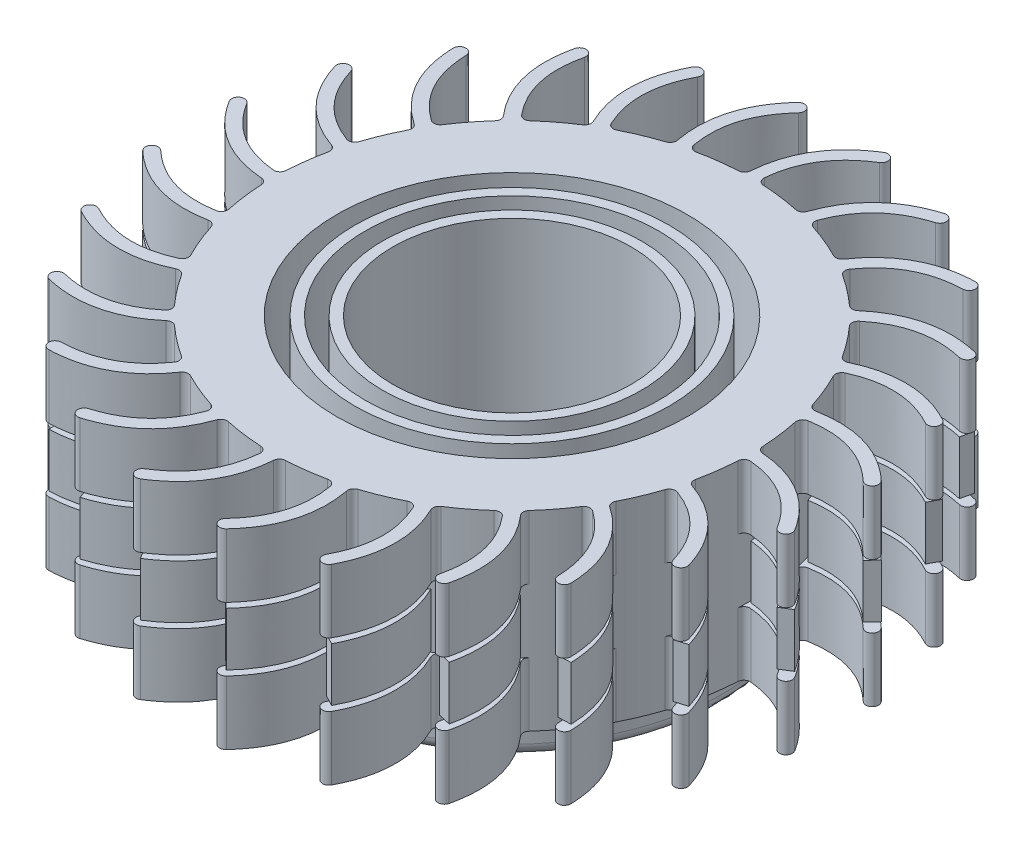
from build123d import *

# Parameters (mm, degrees)
SKETCH1_R                = 18.75
SKETCH1_R_2              = 13.75
BOSS_EXTRUDE1_DEPTH      = 15
BOSS_EXTRUDE2_DEPTH      = 5
FILLET1_R                = 0.5
FILLET2_DEPTH            = 5
CIRPATTERN1_COUNT        = 24
FILLET1_OF_CIRPATTERN1_R = 0.5
MIRROR1_START            = 10
MIRROR1_DEPTH            = 5
SKETCH3_W                = 2.804646897
SKETCH3_H                = 3
FILLET4_R                = 1
CHAMFER1_SIZE            = 1
CHAMFER1_SIZE_2          = 0.73215761
BOSS_EXTRUDE3_DEPTH      = 4.2
CIRPATTERN4_COUNT        = 24
BOSS_EXTRUDE4_REACH      = 44.117
SKETCH6_R                = 12.317160209
SKETCH6_R_2              = 11.517160209
SKETCH6_R_3              = 10.154712578
SKETCH6_R_4              = 9.354712578


with BuildPart() as part:
    # Sketch1 → Boss-Extrude1 (new body)
    with BuildSketch(Plane(origin=(0, 0, 0), x_dir=(1, 0, 0), z_dir=(0, 1, 0))):
        with Locations(Location((0, 0, 0), (0, 0, 270))):
            Circle(SKETCH1_R)
        with Locations(Location((0, 0, 0), (0, 0, 270))):
            Circle(SKETCH1_R_2, mode=Mode.SUBTRACT)
    extrude(amount=BOSS_EXTRUDE1_DEPTH)

    # Sketch2 → Boss-Extrude2 (add)
    with BuildSketch(Plane(origin=(0, 0, 0), x_dir=(1, 0, 0), z_dir=(0, 1, 0))):
        with BuildLine():
            ThreePointArc((18.75, 0), (18.74833243, -0.250062213), (18.743330015, -0.500079947))
            add(Edge.make_bspline(
                [(18.743330015, -0.500079947), (20.249175085, -0.554696371), (22.276517283, -1.391892892), (24.018730993, -2.731723154), (24.82083161, -4.014422972)],
                knots=[0.001258871, 0.001258871, 0.001258871, 0.375, 0.625, 1, 1, 1], degree=2))
            ThreePointArc((24.82083161, -4.014422972), (25.509613501, -4.174358919), (25.669549447, -3.485577028))
            add(Edge.make_bspline(
                [(18.766817552, 0.49971709), (20.440613064, 0.445794798), (22.781173245, -0.517803125), (24.785953616, -2.06298874), (25.669549447, -3.485577028)],
                knots=[0, 0, 0, 0.375, 0.625, 1, 1, 1], degree=2))
            Line((18.766817552, 0.49971709), (18.743339693, 0.49971709))
            ThreePointArc((18.743339693, 0.49971709), (18.748334849, 0.249880736), (18.75, 0))
        make_face()
    boss_extrude2 = extrude(amount=BOSS_EXTRUDE2_DEPTH)

    # Fillet1
    fillet1_edges = [part.edges().sort_by_distance(p)[0] for p in [
        (18.743330015, 2.5, 0.500079947),
    ]]
    fillet(fillet1_edges, radius=FILLET1_R)

    # Fillet2: read off the stored shape, not the designer's step
    # Fillet2 outline → Fillet2 (add)
    with BuildSketch(Plane(origin=(0, 0, 0), x_dir=(1, 0, 0), z_dir=(0, 1, 0))):
        with BuildLine():
            add(Edge.make_bspline(
                [(18.766817552, 0.49971709), (18.979861137, 0.492853767), (19.188539307, 0.47749748)],
                knots=[0, 0, 0, 0.047730648, 0.047730648, 0.047730648], degree=2))
            ThreePointArc((19.188539307, 0.47749748), (18.867686512, 0.626635767), (18.725877539, 0.950794618))
            ThreePointArc((18.725877539, 0.950794618), (18.735966154, 0.725308407), (18.743339693, 0.49971709))
            Line((18.743339693, 0.49971709), (18.766817552, 0.49971709))
        make_face()
    fillet2 = extrude(amount=FILLET2_DEPTH)

    # CirPattern1: Boss-Extrude2, Fillet2 ×24 about axis
    cirpattern1_axis = Axis((0, 15, 0), (0, 1, 0))
    add([boss_extrude2.rotate(cirpattern1_axis, i * 360 / CIRPATTERN1_COUNT) for i in range(1, CIRPATTERN1_COUNT)])
    add([fillet2.rotate(cirpattern1_axis, i * 360 / CIRPATTERN1_COUNT) for i in range(1, CIRPATTERN1_COUNT)])

    # Fillet1 of CirPattern1
    fillet1_of_cirpattern1_edges = [part.edges().sort_by_distance(p)[0] for p in [
        (18.234096746, 2.5, -4.368090641),
        (16.482239918, 2.5, -8.93858307),
        (13.607145677, 2.5, -12.899925834),
        (9.804746945, 2.5, -15.982159971),
        (5.334170912, 2.5, -17.975236318),
        (0.500079947, 2.5, -18.743330015),
        (-4.368090641, 2.5, -18.234096746),
        (-8.93858307, 2.5, -16.482239918),
        (-12.899925834, 2.5, -13.607145677),
        (-15.982159971, 2.5, -9.804746945),
        (-17.975236318, 2.5, -5.334170912),
        (-18.743330015, 2.5, -0.500079947),
        (-18.234096746, 2.5, 4.368090641),
        (-16.482239918, 2.5, 8.93858307),
        (-13.607145677, 2.5, 12.899925834),
        (-9.804746945, 2.5, 15.982159971),
        (-5.334170912, 2.5, 17.975236318),
        (-0.500079947, 2.5, 18.743330015),
        (4.368090641, 2.5, 18.234096746),
        (8.93858307, 2.5, 16.482239918),
        (12.899925834, 2.5, 13.607145677),
        (15.982159971, 2.5, 9.804746945),
        (17.975236318, 2.5, 5.334170912),
    ]]
    fillet(fillet1_of_cirpattern1_edges, radius=FILLET1_OF_CIRPATTERN1_R)

    # Mirror1: read off the stored shape, not the designer's step
    # Mirror1 outline → Mirror1 (add)
    with BuildSketch(Plane(origin=(0, 0, 0), x_dir=(1, 0, 0), z_dir=(0, 1, 0)).offset(MIRROR1_START)):
        with BuildLine():
            ThreePointArc((18.723067695, -1.004607436), (18.895412165, -0.653095529), (19.268186532, -0.533502434))
            add(Edge.make_bspline(
                [(19.268186532, -0.533502434), (20.464567735, -0.643643356), (22.276517283, -1.391892892), (24.018730993, -2.731723154), (24.82083161, -4.014422972)],
                knots=[0.067527533, 0.067527533, 0.067527533, 0.375, 0.625, 1, 1, 1], degree=2))
            ThreePointArc((24.82083161, -4.014422972), (25.509613501, -4.174358919), (25.669549447, -3.485577028))
            add(Edge.make_bspline(
                [(19.188539307, 0.47749748), (20.61935939, 0.372205753), (22.781173245, -0.517803125), (24.785953616, -2.06298874), (25.669549447, -3.485577028)],
                knots=[0.047730648, 0.047730648, 0.047730648, 0.375, 0.625, 1, 1, 1], degree=2))
            ThreePointArc((19.188539307, 0.47749748), (18.867686512, 0.626635767), (18.725877539, 0.950794618))
            ThreePointArc((18.725877539, 0.950794618), (18.749980642, -0.026943063), (18.723067695, -1.004607436))
        make_face()
        with BuildLine():
            ThreePointArc((18.658291127, -4.505132273), (18.386970955, -4.278032935), (18.33389249, -3.928216666))
            ThreePointArc((18.33389249, -3.928216666), (18.104117167, -4.878877086), (17.825083096, -5.81626277))
            ThreePointArc((17.825083096, -5.81626277), (18.082533046, -5.521334371), (18.473558406, -5.502297418))
            add(Edge.make_bspline(
                [(18.473558406, -5.502297418), (19.60066734, -5.91833162), (21.157214974, -7.110052223), (22.493290602, -8.855146965), (22.936073162, -10.301738762)],
                knots=[0.067527533, 0.067527533, 0.067527533, 0.375, 0.625, 1, 1, 1], degree=2))
            ThreePointArc((22.936073162, -10.301738762), (23.55999091, -10.634494895), (23.892747042, -10.010577147))
            add(Edge.make_bspline(
                [(18.658291127, -4.505132273), (20.013105694, -4.977159759), (21.87090628, -6.396360917), (23.407451951, -8.40777095), (23.892747042, -10.010577147)],
                knots=[0.047730648, 0.047730648, 0.047730648, 0.375, 0.625, 1, 1, 1], degree=2))
        make_face()
        with BuildLine():
            ThreePointArc((16.856511241, -9.180744706), (16.653213713, -8.891160762), (16.692482966, -8.539526476))
            ThreePointArc((16.692482966, -8.539526476), (16.224488025, -9.398323698), (15.712348542, -10.231549408))
            ThreePointArc((15.712348542, -10.231549408), (16.037359185, -10.013303401), (16.419987804, -10.096119927))
            add(Edge.make_bspline(
                [(16.419987804, -10.096119927), (17.401013857, -10.789695365), (18.596083429, -12.343673245), (19.434969629, -14.375107144), (19.488259231, -15.88700808)],
                knots=[0.067527533, 0.067527533, 0.067527533, 0.375, 0.625, 1, 1, 1], degree=2))
            ThreePointArc((19.488259231, -15.88700808), (20.004793873, -16.369907618), (20.487693411, -15.853372976))
            add(Edge.make_bspline(
                [(16.856511241, -9.180744706), (18.042991918, -9.987340058), (19.470173196, -11.839017283), (20.433771119, -14.179577464), (20.487693411, -15.853372976)],
                knots=[0.047730648, 0.047730648, 0.047730648, 0.375, 0.625, 1, 1, 1], degree=2))
        make_face()
        with BuildLine():
            ThreePointArc((17.841724979, 5.76501082), (18.118063922, 4.826827085), (18.345106171, 3.875510235))
            ThreePointArc((18.345106171, 3.875510235), (18.420600169, 4.259650695), (18.749719587, 4.47164986))
            add(Edge.make_bspline(
                [(18.749719587, 4.47164986), (19.933841658, 4.674908139), (21.877711753, 4.42112164), (23.907334559, 3.577863075), (25.014091402, 2.546469109)],
                knots=[0.067527533, 0.067527533, 0.067527533, 0.375, 0.625, 1, 1, 1], degree=2))
            ThreePointArc((25.014091402, 2.546469109), (25.720798088, 2.570252719), (25.697014478, 3.276959405))
            add(Edge.make_bspline(
                [(18.411120244, 5.427586568), (19.820437819, 5.696206057), (22.138940901, 5.396042094), (24.475333503, 4.422382744), (25.697014478, 3.276959405)],
                knots=[0.047730648, 0.047730648, 0.047730648, 0.375, 0.625, 1, 1, 1], degree=2))
            ThreePointArc((18.411120244, 5.427586568), (18.062600413, 5.488600278), (17.841724979, 5.76501082))
        make_face()
        with BuildLine():
            ThreePointArc((13.905987971, -13.230704559), (13.784567478, -12.898370677), (13.913508313, -12.568881669))
            ThreePointArc((13.913508313, -12.568881669), (13.239186836, -13.277290082), (12.528843401, -13.949572862))
            ThreePointArc((12.528843401, -13.949572862), (12.899265798, -13.822882352), (13.247422169, -14.001908547))
            add(Edge.make_bspline(
                [(13.247422169, -14.001908547), (14.015510037, -14.925759201), (14.76765953, -16.736093335), (15.052187594, -18.915427527), (14.71235264, -20.389604052)],
                knots=[0.067527533, 0.067527533, 0.067527533, 0.375, 0.625, 1, 1, 1], degree=2))
            ThreePointArc((14.71235264, -20.389604052), (15.086303193, -20.98973819), (15.686437331, -20.615787637))
            add(Edge.make_bspline(
                [(13.905987971, -13.230704559), (14.84327806, -14.316899637), (15.742579984, -16.474864186), (16.067562553, -18.985069208), (15.686437331, -20.615787637)],
                knots=[0.047730648, 0.047730648, 0.047730648, 0.375, 0.625, 1, 1, 1], degree=2))
        make_face()
        with BuildLine():
            ThreePointArc((15.741688348, 10.186351062), (16.251431088, 9.351656944), (16.716955978, 8.491518287))
            ThreePointArc((16.716955978, 8.491518287), (16.690454714, 8.882108763), (16.953490238, 9.172066605))
            add(Edge.make_bspline(
                [(16.953490238, 9.172066605), (18.044657214, 9.67487237), (19.987976321, 9.932844038), (22.166692783, 9.643623848), (23.502682203, 8.933823529)],
                knots=[0.067527533, 0.067527533, 0.067527533, 0.375, 0.625, 1, 1, 1], degree=2))
            ThreePointArc((23.502682203, 8.933823529), (24.179152792, 9.139705882), (23.973270439, 9.816176471))
            add(Edge.make_bspline(
                [(16.379013761, 10.007794601), (17.670786165, 10.632019332), (19.987976321, 10.942155962), (22.496759858, 10.606376152), (23.973270439, 9.816176471)],
                knots=[0.047730648, 0.047730648, 0.047730648, 0.375, 0.625, 1, 1, 1], degree=2))
            ThreePointArc((16.379013761, 10.007794601), (16.026577946, 9.976525749), (15.741688348, 10.186351062))
        make_face()
        with BuildLine():
            ThreePointArc((10.007794601, -16.379013761), (9.976525749, -16.026577946), (10.186351062, -15.741688348))
            ThreePointArc((10.186351062, -15.741688348), (9.351656944, -16.251431088), (8.491518287, -16.716955978))
            ThreePointArc((8.491518287, -16.716955978), (8.882108763, -16.690454714), (9.172066605, -16.953490238))
            add(Edge.make_bspline(
                [(9.172066605, -16.953490238), (9.67487237, -18.044657214), (9.932844038, -19.987976321), (9.643623848, -22.166692783), (8.933823529, -23.502682203)],
                knots=[0.067527533, 0.067527533, 0.067527533, 0.375, 0.625, 1, 1, 1], degree=2))
            ThreePointArc((8.933823529, -23.502682203), (9.139705882, -24.179152792), (9.816176471, -23.973270439))
            add(Edge.make_bspline(
                [(10.007794601, -16.379013761), (10.632019332, -17.670786165), (10.942155962, -19.987976321), (10.606376152, -22.496759858), (9.816176471, -23.973270439)],
                knots=[0.047730648, 0.047730648, 0.047730648, 0.375, 0.625, 1, 1, 1], degree=2))
        make_face()
        with BuildLine():
            ThreePointArc((12.568881669, 13.913508313), (13.277290082, 13.239186836), (13.949572862, 12.528843401))
            ThreePointArc((13.949572862, 12.528843401), (13.822882352, 12.899265798), (14.001908547, 13.247422169))
            add(Edge.make_bspline(
                [(14.001908547, 13.247422169), (14.925759201, 14.015510037), (16.736093335, 14.76765953), (18.915427527, 15.052187594), (20.389604052, 14.71235264)],
                knots=[0.067527533, 0.067527533, 0.067527533, 0.375, 0.625, 1, 1, 1], degree=2))
            ThreePointArc((20.389604052, 14.71235264), (20.98973819, 15.086303193), (20.615787637, 15.686437331))
            add(Edge.make_bspline(
                [(13.230704559, 13.905987971), (14.316899637, 14.84327806), (16.474864186, 15.742579984), (18.985069208, 16.067562553), (20.615787637, 15.686437331)],
                knots=[0.047730648, 0.047730648, 0.047730648, 0.375, 0.625, 1, 1, 1], degree=2))
            ThreePointArc((13.230704559, 13.905987971), (12.898370677, 13.784567478), (12.568881669, 13.913508313))
        make_face()
        with BuildLine():
            ThreePointArc((5.427586568, -18.411120244), (5.488600278, -18.062600413), (5.76501082, -17.841724979))
            ThreePointArc((5.76501082, -17.841724979), (4.826827085, -18.118063922), (3.875510235, -18.345106171))
            ThreePointArc((3.875510235, -18.345106171), (4.259650695, -18.420600169), (4.47164986, -18.749719587))
            add(Edge.make_bspline(
                [(4.47164986, -18.749719587), (4.674908139, -19.933841658), (4.42112164, -21.877711753), (3.577863075, -23.907334559), (2.546469109, -25.014091402)],
                knots=[0.067527533, 0.067527533, 0.067527533, 0.375, 0.625, 1, 1, 1], degree=2))
            ThreePointArc((2.546469109, -25.014091402), (2.570252719, -25.720798088), (3.276959405, -25.697014478))
            add(Edge.make_bspline(
                [(5.427586568, -18.411120244), (5.696206057, -19.820437819), (5.396042094, -22.138940901), (4.422382744, -24.475333503), (3.276959405, -25.697014478)],
                knots=[0.047730648, 0.047730648, 0.047730648, 0.375, 0.625, 1, 1, 1], degree=2))
        make_face()
        with BuildLine():
            ThreePointArc((8.539526476, 16.692482966), (9.398323698, 16.224488025), (10.231549408, 15.712348542))
            ThreePointArc((10.231549408, 15.712348542), (10.013303401, 16.037359185), (10.096119927, 16.419987804))
            add(Edge.make_bspline(
                [(10.096119927, 16.419987804), (10.789695365, 17.401013857), (12.343673245, 18.596083429), (14.375107144, 19.434969629), (15.88700808, 19.488259231)],
                knots=[0.067527533, 0.067527533, 0.067527533, 0.375, 0.625, 1, 1, 1], degree=2))
            ThreePointArc((15.88700808, 19.488259231), (16.369907618, 20.004793873), (15.853372976, 20.487693411))
            add(Edge.make_bspline(
                [(9.180744706, 16.856511241), (9.987340058, 18.042991918), (11.839017283, 19.470173196), (14.179577464, 20.433771119), (15.853372976, 20.487693411)],
                knots=[0.047730648, 0.047730648, 0.047730648, 0.375, 0.625, 1, 1, 1], degree=2))
            ThreePointArc((9.180744706, 16.856511241), (8.891160762, 16.653213713), (8.539526476, 16.692482966))
        make_face()
        with BuildLine():
            ThreePointArc((0.47749748, -19.188539307), (0.626635767, -18.867686512), (0.950794618, -18.725877539))
            ThreePointArc((0.950794618, -18.725877539), (-0.026943063, -18.749980642), (-1.004607436, -18.723067695))
            ThreePointArc((-1.004607436, -18.723067695), (-0.653095529, -18.895412165), (-0.533502434, -19.268186532))
            add(Edge.make_bspline(
                [(-0.533502434, -19.268186532), (-0.643643356, -20.464567735), (-1.391892892, -22.276517283), (-2.731723154, -24.018730993), (-4.014422972, -24.82083161)],
                knots=[0.067527533, 0.067527533, 0.067527533, 0.375, 0.625, 1, 1, 1], degree=2))
            ThreePointArc((-4.014422972, -24.82083161), (-4.174358919, -25.509613501), (-3.485577028, -25.669549447))
            add(Edge.make_bspline(
                [(0.47749748, -19.188539307), (0.372205753, -20.61935939), (-0.517803125, -22.781173245), (-2.06298874, -24.785953616), (-3.485577028, -25.669549447)],
                knots=[0.047730648, 0.047730648, 0.047730648, 0.375, 0.625, 1, 1, 1], degree=2))
        make_face()
        with BuildLine():
            ThreePointArc((3.928216666, 18.33389249), (4.878877086, 18.104117167), (5.81626277, 17.825083096))
            ThreePointArc((5.81626277, 17.825083096), (5.521334371, 18.082533046), (5.502297418, 18.473558406))
            add(Edge.make_bspline(
                [(5.502297418, 18.473558406), (5.91833162, 19.60066734), (7.110052223, 21.157214974), (8.855146965, 22.493290602), (10.301738762, 22.936073162)],
                knots=[0.067527533, 0.067527533, 0.067527533, 0.375, 0.625, 1, 1, 1], degree=2))
            ThreePointArc((10.301738762, 22.936073162), (10.634494895, 23.55999091), (10.010577147, 23.892747042))
            add(Edge.make_bspline(
                [(4.505132273, 18.658291127), (4.977159759, 20.013105694), (6.396360917, 21.87090628), (8.40777095, 23.407451951), (10.010577147, 23.892747042)],
                knots=[0.047730648, 0.047730648, 0.047730648, 0.375, 0.625, 1, 1, 1], degree=2))
            ThreePointArc((4.505132273, 18.658291127), (4.278032935, 18.386970955), (3.928216666, 18.33389249))
        make_face()
        with BuildLine():
            ThreePointArc((-4.505132273, -18.658291127), (-4.278032935, -18.386970955), (-3.928216666, -18.33389249))
            ThreePointArc((-3.928216666, -18.33389249), (-4.878877086, -18.104117167), (-5.81626277, -17.825083096))
            ThreePointArc((-5.81626277, -17.825083096), (-5.521334371, -18.082533046), (-5.502297418, -18.473558406))
            add(Edge.make_bspline(
                [(-5.502297418, -18.473558406), (-5.91833162, -19.60066734), (-7.110052223, -21.157214974), (-8.855146965, -22.493290602), (-10.301738762, -22.936073162)],
                knots=[0.067527533, 0.067527533, 0.067527533, 0.375, 0.625, 1, 1, 1], degree=2))
            ThreePointArc((-10.301738762, -22.936073162), (-10.634494895, -23.55999091), (-10.010577147, -23.892747042))
            add(Edge.make_bspline(
                [(-4.505132273, -18.658291127), (-4.977159759, -20.013105694), (-6.396360917, -21.87090628), (-8.40777095, -23.407451951), (-10.010577147, -23.892747042)],
                knots=[0.047730648, 0.047730648, 0.047730648, 0.375, 0.625, 1, 1, 1], degree=2))
        make_face()
        with BuildLine():
            ThreePointArc((-0.950794618, 18.725877539), (0.026943063, 18.749980642), (1.004607436, 18.723067695))
            ThreePointArc((1.004607436, 18.723067695), (0.653095529, 18.895412165), (0.533502434, 19.268186532))
            add(Edge.make_bspline(
                [(0.533502434, 19.268186532), (0.643643356, 20.464567735), (1.391892892, 22.276517283), (2.731723154, 24.018730993), (4.014422972, 24.82083161)],
                knots=[0.067527533, 0.067527533, 0.067527533, 0.375, 0.625, 1, 1, 1], degree=2))
            ThreePointArc((4.014422972, 24.82083161), (4.174358919, 25.509613501), (3.485577028, 25.669549447))
            add(Edge.make_bspline(
                [(-0.47749748, 19.188539307), (-0.372205753, 20.61935939), (0.517803125, 22.781173245), (2.06298874, 24.785953616), (3.485577028, 25.669549447)],
                knots=[0.047730648, 0.047730648, 0.047730648, 0.375, 0.625, 1, 1, 1], degree=2))
            ThreePointArc((-0.47749748, 19.188539307), (-0.626635767, 18.867686512), (-0.950794618, 18.725877539))
        make_face()
        with BuildLine():
            ThreePointArc((-9.180744706, -16.856511241), (-8.891160762, -16.653213713), (-8.539526476, -16.692482966))
            ThreePointArc((-8.539526476, -16.692482966), (-9.398323698, -16.224488025), (-10.231549408, -15.712348542))
            ThreePointArc((-10.231549408, -15.712348542), (-10.013303401, -16.037359185), (-10.096119927, -16.419987804))
            add(Edge.make_bspline(
                [(-10.096119927, -16.419987804), (-10.789695365, -17.401013857), (-12.343673245, -18.596083429), (-14.375107144, -19.434969629), (-15.88700808, -19.488259231)],
                knots=[0.067527533, 0.067527533, 0.067527533, 0.375, 0.625, 1, 1, 1], degree=2))
            ThreePointArc((-15.88700808, -19.488259231), (-16.369907618, -20.004793873), (-15.853372976, -20.487693411))
            add(Edge.make_bspline(
                [(-9.180744706, -16.856511241), (-9.987340058, -18.042991918), (-11.839017283, -19.470173196), (-14.179577464, -20.433771119), (-15.853372976, -20.487693411)],
                knots=[0.047730648, 0.047730648, 0.047730648, 0.375, 0.625, 1, 1, 1], degree=2))
        make_face()
        with BuildLine():
            ThreePointArc((-5.76501082, 17.841724979), (-4.826827085, 18.118063922), (-3.875510235, 18.345106171))
            ThreePointArc((-3.875510235, 18.345106171), (-4.259650695, 18.420600169), (-4.47164986, 18.749719587))
            add(Edge.make_bspline(
                [(-4.47164986, 18.749719587), (-4.674908139, 19.933841658), (-4.42112164, 21.877711753), (-3.577863075, 23.907334559), (-2.546469109, 25.014091402)],
                knots=[0.067527533, 0.067527533, 0.067527533, 0.375, 0.625, 1, 1, 1], degree=2))
            ThreePointArc((-2.546469109, 25.014091402), (-2.570252719, 25.720798088), (-3.276959405, 25.697014478))
            add(Edge.make_bspline(
                [(-5.427586568, 18.411120244), (-5.696206057, 19.820437819), (-5.396042094, 22.138940901), (-4.422382744, 24.475333503), (-3.276959405, 25.697014478)],
                knots=[0.047730648, 0.047730648, 0.047730648, 0.375, 0.625, 1, 1, 1], degree=2))
            ThreePointArc((-5.427586568, 18.411120244), (-5.488600278, 18.062600413), (-5.76501082, 17.841724979))
        make_face()
        with BuildLine():
            ThreePointArc((-13.230704559, -13.905987971), (-12.898370677, -13.784567478), (-12.568881669, -13.913508313))
            ThreePointArc((-12.568881669, -13.913508313), (-13.277290082, -13.239186836), (-13.949572862, -12.528843401))
            ThreePointArc((-13.949572862, -12.528843401), (-13.822882352, -12.899265798), (-14.001908547, -13.247422169))
            add(Edge.make_bspline(
                [(-14.001908547, -13.247422169), (-14.925759201, -14.015510037), (-16.736093335, -14.76765953), (-18.915427527, -15.052187594), (-20.389604052, -14.71235264)],
                knots=[0.067527533, 0.067527533, 0.067527533, 0.375, 0.625, 1, 1, 1], degree=2))
            ThreePointArc((-20.389604052, -14.71235264), (-20.98973819, -15.086303193), (-20.615787637, -15.686437331))
            add(Edge.make_bspline(
                [(-13.230704559, -13.905987971), (-14.316899637, -14.84327806), (-16.474864186, -15.742579984), (-18.985069208, -16.067562553), (-20.615787637, -15.686437331)],
                knots=[0.047730648, 0.047730648, 0.047730648, 0.375, 0.625, 1, 1, 1], degree=2))
        make_face()
        with BuildLine():
            ThreePointArc((-10.186351062, 15.741688348), (-9.351656944, 16.251431088), (-8.491518287, 16.716955978))
            ThreePointArc((-8.491518287, 16.716955978), (-8.882108763, 16.690454714), (-9.172066605, 16.953490238))
            add(Edge.make_bspline(
                [(-9.172066605, 16.953490238), (-9.67487237, 18.044657214), (-9.932844038, 19.987976321), (-9.643623848, 22.166692783), (-8.933823529, 23.502682203)],
                knots=[0.067527533, 0.067527533, 0.067527533, 0.375, 0.625, 1, 1, 1], degree=2))
            ThreePointArc((-8.933823529, 23.502682203), (-9.139705882, 24.179152792), (-9.816176471, 23.973270439))
            add(Edge.make_bspline(
                [(-10.007794601, 16.379013761), (-10.632019332, 17.670786165), (-10.942155962, 19.987976321), (-10.606376152, 22.496759858), (-9.816176471, 23.973270439)],
                knots=[0.047730648, 0.047730648, 0.047730648, 0.375, 0.625, 1, 1, 1], degree=2))
            ThreePointArc((-10.007794601, 16.379013761), (-9.976525749, 16.026577946), (-10.186351062, 15.741688348))
        make_face()
        with BuildLine():
            ThreePointArc((-16.379013761, -10.007794601), (-16.026577946, -9.976525749), (-15.741688348, -10.186351062))
            ThreePointArc((-15.741688348, -10.186351062), (-16.251431088, -9.351656944), (-16.716955978, -8.491518287))
            ThreePointArc((-16.716955978, -8.491518287), (-16.690454714, -8.882108763), (-16.953490238, -9.172066605))
            add(Edge.make_bspline(
                [(-16.953490238, -9.172066605), (-18.044657214, -9.67487237), (-19.987976321, -9.932844038), (-22.166692783, -9.643623848), (-23.502682203, -8.933823529)],
                knots=[0.067527533, 0.067527533, 0.067527533, 0.375, 0.625, 1, 1, 1], degree=2))
            ThreePointArc((-23.502682203, -8.933823529), (-24.179152792, -9.139705882), (-23.973270439, -9.816176471))
            add(Edge.make_bspline(
                [(-16.379013761, -10.007794601), (-17.670786165, -10.632019332), (-19.987976321, -10.942155962), (-22.496759858, -10.606376152), (-23.973270439, -9.816176471)],
                knots=[0.047730648, 0.047730648, 0.047730648, 0.375, 0.625, 1, 1, 1], degree=2))
        make_face()
        with BuildLine():
            ThreePointArc((-13.913508313, 12.568881669), (-13.239186836, 13.277290082), (-12.528843401, 13.949572862))
            ThreePointArc((-12.528843401, 13.949572862), (-12.899265798, 13.822882352), (-13.247422169, 14.001908547))
            add(Edge.make_bspline(
                [(-13.247422169, 14.001908547), (-14.015510037, 14.925759201), (-14.76765953, 16.736093335), (-15.052187594, 18.915427527), (-14.71235264, 20.389604052)],
                knots=[0.067527533, 0.067527533, 0.067527533, 0.375, 0.625, 1, 1, 1], degree=2))
            ThreePointArc((-14.71235264, 20.389604052), (-15.086303193, 20.98973819), (-15.686437331, 20.615787637))
            add(Edge.make_bspline(
                [(-13.905987971, 13.230704559), (-14.84327806, 14.316899637), (-15.742579984, 16.474864186), (-16.067562553, 18.985069208), (-15.686437331, 20.615787637)],
                knots=[0.047730648, 0.047730648, 0.047730648, 0.375, 0.625, 1, 1, 1], degree=2))
            ThreePointArc((-13.905987971, 13.230704559), (-13.784567478, 12.898370677), (-13.913508313, 12.568881669))
        make_face()
        with BuildLine():
            ThreePointArc((-18.411120244, -5.427586568), (-18.062600413, -5.488600278), (-17.841724979, -5.76501082))
            ThreePointArc((-17.841724979, -5.76501082), (-18.118063922, -4.826827085), (-18.345106171, -3.875510235))
            ThreePointArc((-18.345106171, -3.875510235), (-18.420600169, -4.259650695), (-18.749719587, -4.47164986))
            add(Edge.make_bspline(
                [(-18.749719587, -4.47164986), (-19.933841658, -4.674908139), (-21.877711753, -4.42112164), (-23.907334559, -3.577863075), (-25.014091402, -2.546469109)],
                knots=[0.067527533, 0.067527533, 0.067527533, 0.375, 0.625, 1, 1, 1], degree=2))
            ThreePointArc((-25.014091402, -2.546469109), (-25.720798088, -2.570252719), (-25.697014478, -3.276959405))
            add(Edge.make_bspline(
                [(-18.411120244, -5.427586568), (-19.820437819, -5.696206057), (-22.138940901, -5.396042094), (-24.475333503, -4.422382744), (-25.697014478, -3.276959405)],
                knots=[0.047730648, 0.047730648, 0.047730648, 0.375, 0.625, 1, 1, 1], degree=2))
        make_face()
        with BuildLine():
            ThreePointArc((-16.692482966, 8.539526476), (-16.224488025, 9.398323698), (-15.712348542, 10.231549408))
            ThreePointArc((-15.712348542, 10.231549408), (-16.037359185, 10.013303401), (-16.419987804, 10.096119927))
            add(Edge.make_bspline(
                [(-16.419987804, 10.096119927), (-17.401013857, 10.789695365), (-18.596083429, 12.343673245), (-19.434969629, 14.375107144), (-19.488259231, 15.88700808)],
                knots=[0.067527533, 0.067527533, 0.067527533, 0.375, 0.625, 1, 1, 1], degree=2))
            ThreePointArc((-19.488259231, 15.88700808), (-20.004793873, 16.369907618), (-20.487693411, 15.853372976))
            add(Edge.make_bspline(
                [(-16.856511241, 9.180744706), (-18.042991918, 9.987340058), (-19.470173196, 11.839017283), (-20.433771119, 14.179577464), (-20.487693411, 15.853372976)],
                knots=[0.047730648, 0.047730648, 0.047730648, 0.375, 0.625, 1, 1, 1], degree=2))
            ThreePointArc((-16.856511241, 9.180744706), (-16.653213713, 8.891160762), (-16.692482966, 8.539526476))
        make_face()
        with BuildLine():
            ThreePointArc((-19.188539307, -0.47749748), (-18.867686512, -0.626635767), (-18.725877539, -0.950794618))
            ThreePointArc((-18.725877539, -0.950794618), (-18.749980642, 0.026943063), (-18.723067695, 1.004607436))
            ThreePointArc((-18.723067695, 1.004607436), (-18.895412165, 0.653095529), (-19.268186532, 0.533502434))
            add(Edge.make_bspline(
                [(-19.268186532, 0.533502434), (-20.464567735, 0.643643356), (-22.276517283, 1.391892892), (-24.018730993, 2.731723154), (-24.82083161, 4.014422972)],
                knots=[0.067527533, 0.067527533, 0.067527533, 0.375, 0.625, 1, 1, 1], degree=2))
            ThreePointArc((-24.82083161, 4.014422972), (-25.509613501, 4.174358919), (-25.669549447, 3.485577028))
            add(Edge.make_bspline(
                [(-19.188539307, -0.47749748), (-20.61935939, -0.372205753), (-22.781173245, 0.517803125), (-24.785953616, 2.06298874), (-25.669549447, 3.485577028)],
                knots=[0.047730648, 0.047730648, 0.047730648, 0.375, 0.625, 1, 1, 1], degree=2))
        make_face()
        with BuildLine():
            ThreePointArc((-18.33389249, 3.928216666), (-18.104117167, 4.878877086), (-17.825083096, 5.81626277))
            ThreePointArc((-17.825083096, 5.81626277), (-18.082533046, 5.521334371), (-18.473558406, 5.502297418))
            add(Edge.make_bspline(
                [(-18.473558406, 5.502297418), (-19.60066734, 5.91833162), (-21.157214974, 7.110052223), (-22.493290602, 8.855146965), (-22.936073162, 10.301738762)],
                knots=[0.067527533, 0.067527533, 0.067527533, 0.375, 0.625, 1, 1, 1], degree=2))
            ThreePointArc((-22.936073162, 10.301738762), (-23.55999091, 10.634494895), (-23.892747042, 10.010577147))
            add(Edge.make_bspline(
                [(-18.658291127, 4.505132273), (-20.013105694, 4.977159759), (-21.87090628, 6.396360917), (-23.407451951, 8.40777095), (-23.892747042, 10.010577147)],
                knots=[0.047730648, 0.047730648, 0.047730648, 0.375, 0.625, 1, 1, 1], degree=2))
            ThreePointArc((-18.658291127, 4.505132273), (-18.386970955, 4.278032935), (-18.33389249, 3.928216666))
        make_face()
    extrude(amount=MIRROR1_DEPTH)

    # Sketch3 → Revolve1 (revolve)
    with BuildSketch(Plane(origin=(0, 0, 0), x_dir=(0, 0, -1), z_dir=(1, 0, 0))):
        Polygon((-13.75, -3), (-16.554646897, -3), (-11.525384879, -5.9), (-8.720737982, -5.9), align=None)
        with Locations((-15.152323449, -1.5)):
            Rectangle(SKETCH3_W, SKETCH3_H)
    revolve(axis=Axis((0, 18.651226741, 0), (0, -1, 0)))

    # Fillet4
    fillet4_edges = [part.edges().sort_by_distance(p)[0] for p in [
        (0, 0, -16.554646897),
        (0, -3, -13.75),
        (0, -3, -16.554646897),
        (0, -5.9, -11.525384879),
    ]]
    fillet(fillet4_edges, radius=FILLET4_R)

    # Chamfer1
    # the kernel refuses this chamfer: 1, 0.73215761 mm, written as the material it takes off along each edge
    with BuildSketch(Plane(origin=(0, -5.9, 0), x_dir=(0, 0, 1), z_dir=(1, 0, 0))) as chamfer1_piece_1:
        Polygon((8.720737982 + CHAMFER1_SIZE * 0.866297203575, -CHAMFER1_SIZE * 0.499528933174), (8.720737982 + CHAMFER1_SIZE_2, 0), (8.720737982, 0), align=None)
    revolve(axis=Axis((0, -5.9, 0), (0, -1, 0)), mode=Mode.SUBTRACT)


with BuildPart() as body_2:
    # Sketch5 → Boss-Extrude3 (new body)
    with BuildSketch(Plane(origin=(0, 5.4, 0), x_dir=(1, 0, 0), z_dir=(0, 1, 0))):
        with BuildLine():
            Line((18.411120244, 5.427586568), (18.749719587, 4.47164986))
            add(Edge.make_bspline(
                [(18.749719587, 4.47164986), (19.933841658, 4.674908139), (21.877711753, 4.42112164), (23.907334559, 3.577863075), (25.014091402, 2.546469109)],
                knots=[0.067527533, 0.067527533, 0.067527533, 0.375, 0.625, 1, 1, 1], degree=2))
            Line((25.014091402, 2.546469109), (25.697014478, 3.276959405))
            add(Edge.make_bspline(
                [(18.411120244, 5.427586568), (19.820437819, 5.696206057), (22.138940901, 5.396042094), (24.475333503, 4.422382744), (25.697014478, 3.276959405)],
                knots=[0.047730648, 0.047730648, 0.047730648, 0.375, 0.625, 1, 1, 1], degree=2))
        make_face()
    extrude(amount=BOSS_EXTRUDE3_DEPTH)


with BuildPart() as cirpattern4_1:
    # CirPattern4: pattern copy
    add(body_2.part.rotate(Axis((0, -5.766297204, 0), (0, -1, 0)), 1 * 360 / CIRPATTERN4_COUNT))


with BuildPart() as cirpattern4_2:
    # CirPattern4: pattern copy
    add(body_2.part.rotate(Axis((0, -5.766297204, 0), (0, -1, 0)), 2 * 360 / CIRPATTERN4_COUNT))


with BuildPart() as cirpattern4_3:
    # CirPattern4: pattern copy
    add(body_2.part.rotate(Axis((0, -5.766297204, 0), (0, -1, 0)), 3 * 360 / CIRPATTERN4_COUNT))


with BuildPart() as cirpattern4_4:
    # CirPattern4: pattern copy
    add(body_2.part.rotate(Axis((0, -5.766297204, 0), (0, -1, 0)), 4 * 360 / CIRPATTERN4_COUNT))


with BuildPart() as cirpattern4_5:
    # CirPattern4: pattern copy
    add(body_2.part.rotate(Axis((0, -5.766297204, 0), (0, -1, 0)), 5 * 360 / CIRPATTERN4_COUNT))


with BuildPart() as cirpattern4_6:
    # CirPattern4: pattern copy
    add(body_2.part.rotate(Axis((0, -5.766297204, 0), (0, -1, 0)), 6 * 360 / CIRPATTERN4_COUNT))


with BuildPart() as cirpattern4_7:
    # CirPattern4: pattern copy
    add(body_2.part.rotate(Axis((0, -5.766297204, 0), (0, -1, 0)), 7 * 360 / CIRPATTERN4_COUNT))


with BuildPart() as cirpattern4_8:
    # CirPattern4: pattern copy
    add(body_2.part.rotate(Axis((0, -5.766297204, 0), (0, -1, 0)), 8 * 360 / CIRPATTERN4_COUNT))


with BuildPart() as cirpattern4_9:
    # CirPattern4: pattern copy
    add(body_2.part.rotate(Axis((0, -5.766297204, 0), (0, -1, 0)), 9 * 360 / CIRPATTERN4_COUNT))


with BuildPart() as cirpattern4_10:
    # CirPattern4: pattern copy
    add(body_2.part.rotate(Axis((0, -5.766297204, 0), (0, -1, 0)), 10 * 360 / CIRPATTERN4_COUNT))


with BuildPart() as cirpattern4_11:
    # CirPattern4: pattern copy
    add(body_2.part.rotate(Axis((0, -5.766297204, 0), (0, -1, 0)), 11 * 360 / CIRPATTERN4_COUNT))


with BuildPart() as cirpattern4_12:
    # CirPattern4: pattern copy
    add(body_2.part.rotate(Axis((0, -5.766297204, 0), (0, -1, 0)), 12 * 360 / CIRPATTERN4_COUNT))


with BuildPart() as cirpattern4_13:
    # CirPattern4: pattern copy
    add(body_2.part.rotate(Axis((0, -5.766297204, 0), (0, -1, 0)), 13 * 360 / CIRPATTERN4_COUNT))


with BuildPart() as cirpattern4_14:
    # CirPattern4: pattern copy
    add(body_2.part.rotate(Axis((0, -5.766297204, 0), (0, -1, 0)), 14 * 360 / CIRPATTERN4_COUNT))


with BuildPart() as cirpattern4_15:
    # CirPattern4: pattern copy
    add(body_2.part.rotate(Axis((0, -5.766297204, 0), (0, -1, 0)), 15 * 360 / CIRPATTERN4_COUNT))


with BuildPart() as cirpattern4_16:
    # CirPattern4: pattern copy
    add(body_2.part.rotate(Axis((0, -5.766297204, 0), (0, -1, 0)), 16 * 360 / CIRPATTERN4_COUNT))


with BuildPart() as cirpattern4_17:
    # CirPattern4: pattern copy
    add(body_2.part.rotate(Axis((0, -5.766297204, 0), (0, -1, 0)), 17 * 360 / CIRPATTERN4_COUNT))


with BuildPart() as cirpattern4_18:
    # CirPattern4: pattern copy
    add(body_2.part.rotate(Axis((0, -5.766297204, 0), (0, -1, 0)), 18 * 360 / CIRPATTERN4_COUNT))


with BuildPart() as cirpattern4_19:
    # CirPattern4: pattern copy
    add(body_2.part.rotate(Axis((0, -5.766297204, 0), (0, -1, 0)), 19 * 360 / CIRPATTERN4_COUNT))


with BuildPart() as cirpattern4_20:
    # CirPattern4: pattern copy
    add(body_2.part.rotate(Axis((0, -5.766297204, 0), (0, -1, 0)), 20 * 360 / CIRPATTERN4_COUNT))


with BuildPart() as cirpattern4_21:
    # CirPattern4: pattern copy
    add(body_2.part.rotate(Axis((0, -5.766297204, 0), (0, -1, 0)), 21 * 360 / CIRPATTERN4_COUNT))


with BuildPart() as cirpattern4_22:
    # CirPattern4: pattern copy
    add(body_2.part.rotate(Axis((0, -5.766297204, 0), (0, -1, 0)), 22 * 360 / CIRPATTERN4_COUNT))


with BuildPart() as cirpattern4_23:
    # CirPattern4: pattern copy
    add(body_2.part.rotate(Axis((0, -5.766297204, 0), (0, -1, 0)), 23 * 360 / CIRPATTERN4_COUNT))


with BuildPart() as body_26:
    # Boss-Extrude4: up to this cone (the profile starts inside it)
    boss_extrude4_end = Plane(origin=(0, 15, 0), z_dir=(0, 1, 0)).offset(-25.46686234) * Cone(1.734e-06, 198.134225046, 114.249216998, align=(Align.CENTER, Align.CENTER, Align.MIN), mode=Mode.PRIVATE)
    # Sketch6 → Boss-Extrude4 (new, up to the surface)
    with BuildSketch(Plane(origin=(0, 15, 0), x_dir=(1, 0, 0), z_dir=(0, 1, 0)), mode=Mode.PRIVATE) as boss_extrude4_sk1:
        with Locations(Location((0, 0, 0), (0, 0, 270))):
            Circle(SKETCH6_R)
        with Locations(Location((0, 0, 0), (0, 0, 270))):
            Circle(SKETCH6_R_2, mode=Mode.SUBTRACT)
    boss_extrude4_tool1 = extrude(boss_extrude4_sk1.sketch, amount=-BOSS_EXTRUDE4_REACH, mode=Mode.PRIVATE) & boss_extrude4_end
    add(boss_extrude4_tool1.solids().sort_by_distance((0, 15, -11.968778))[0])
    # Sketch6 → Boss-Extrude4 (new, up to the surface)
    with BuildSketch(Plane(origin=(0, 15, 0), x_dir=(1, 0, 0), z_dir=(0, 1, 0)), mode=Mode.PRIVATE) as boss_extrude4_sk2:
        with Locations(Location((0, 0, 0), (0, 0, 270))):
            Circle(SKETCH6_R_3)
        with Locations(Location((0, 0, 0), (0, 0, 270))):
            Circle(SKETCH6_R_4, mode=Mode.SUBTRACT)
    boss_extrude4_tool2 = extrude(boss_extrude4_sk2.sketch, amount=-BOSS_EXTRUDE4_REACH, mode=Mode.PRIVATE) & boss_extrude4_end
    add(boss_extrude4_tool2.solids().sort_by_distance((0, 15, -9.867494))[0])


solid = Compound([part.part, body_2.part, cirpattern4_1.part, cirpattern4_2.part, cirpattern4_3.part, cirpattern4_4.part, cirpattern4_5.part, cirpattern4_6.part, cirpattern4_7.part, cirpattern4_8.part, cirpattern4_9.part, cirpattern4_10.part, cirpattern4_11.part, cirpattern4_12.part, cirpattern4_13.part, cirpattern4_14.part, cirpattern4_15.part, cirpattern4_16.part, cirpattern4_17.part, cirpattern4_18.part, cirpattern4_19.part, cirpattern4_20.part, cirpattern4_21.part, cirpattern4_22.part, cirpattern4_23.part, body_26.part])
